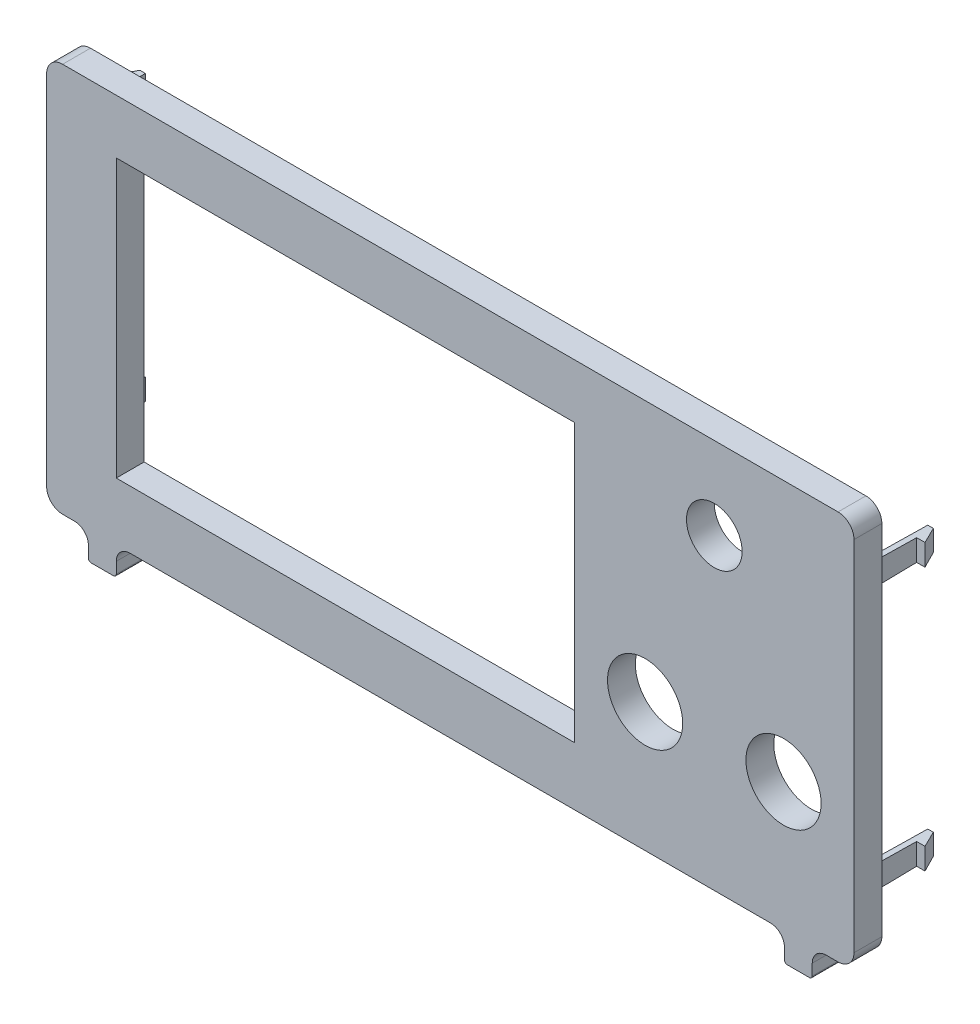
from build123d import *
from OCP.BRepFilletAPI import BRepFilletAPI_MakeFillet

# Parameters (mm, degrees)
SKETCH1_W            = 290
SKETCH1_H            = 140
MAIN_BODY_DEPTH      = 10
SKETCH2_W            = 164.64
SKETCH2_H            = 99.6
DISPLAY_DEPTH        = 10
SKETCH5_W            = 10
SKETCH5_H            = 10
FEET_DEPTH           = 10
FEET_FILLETS_R1      = 5
FEET_FILLETS_R2      = 1
SKETCH8_R            = 10
ROTARY_ENCODER_DEPTH = 10
SKETCH9_R            = 13.5
CONNECTORS_DEPTH     = 10
SNAP_START           = 285.5
SNAP_HOOK1_DEPTH     = 2
SNAP_START_2         = -26.59133039
SNAP_HOOK1_2_DEPTH   = 7.70946078
SNAP_START_3         = 287.5
SNAP_HOOK1_3_DEPTH   = 3.5
SNAP_HOOK2_DEPTH     = 2
SNAP_START_4         = -121.11813039
SNAP_HOOK2_2_DEPTH   = 7.70946078
SNAP_HOOK2_3_DEPTH   = 3.5
SNAP_START_5         = 2.5
SNAP_HOOK3_DEPTH     = 2
SNAP_HOOK3_2_DEPTH   = 7.70946078
SNAP_START_6         = -1
SNAP_HOOK3_3_DEPTH   = 3.5
SNAP_HOOK4_DEPTH     = 2
SNAP_HOOK4_2_DEPTH   = 7.70946078
SNAP_HOOK4_3_DEPTH   = 3.5
SIDE_FILLETS_R       = 5.7366
SKETCH11_R           = 1.5
DISPLAY_HOLES_DEPTH  = 7


with BuildPart() as part:
    # Sketch1 → Main Body (new body)
    with BuildSketch(Plane.XY):
        with Locations((145, -70)):
            Rectangle(SKETCH1_W, SKETCH1_H)
    extrude(amount=MAIN_BODY_DEPTH)

    # Sketch2 → Display (cut)
    with BuildSketch(Plane(origin=(0, 0, 0), x_dir=(-1, 0, 0), z_dir=(0, 0, -1))):
        with Locations((-107.32, -69.3)):
            Rectangle(SKETCH2_W, SKETCH2_H)
    extrude(amount=-DISPLAY_DEPTH, mode=Mode.SUBTRACT)

    # Sketch5 → Feet (add)
    with BuildSketch(Plane.XZ.offset(140)):
        with Locations((20, 5)):
            Rectangle(SKETCH5_W, SKETCH5_H)
        with Locations((270, 5)):
            Rectangle(SKETCH5_W, SKETCH5_H)
    extrude(amount=FEET_DEPTH)

    # Feet Fillets: one fillet with a radius per group of edges: ONE call of the kernel's fillet builder (fillet() takes one radius for all edges)
    feet_fillets_edges_1 = [part.edges().sort_by_distance(p)[0] for p in [
        (15, -140, 5),
        (25, -140, 5),
        (275, -140, 5),
        (265, -140, 5),
    ]]
    feet_fillets_edges_2 = [part.edges().sort_by_distance(p)[0] for p in [
        (265, -150, 5),
        (275, -150, 5),
        (25, -150, 5),
        (15, -150, 5),
    ]]
    feet_fillets = BRepFilletAPI_MakeFillet(part.part.solid().wrapped)
    for e in feet_fillets_edges_1:
        feet_fillets.Add(FEET_FILLETS_R1, e.wrapped)
    for e in feet_fillets_edges_2:
        feet_fillets.Add(FEET_FILLETS_R2, e.wrapped)
    add(Compound.cast(feet_fillets.Shape()), mode=Mode.REPLACE)

    # Sketch8 → Rotary Encoder (cut)
    with BuildSketch(Plane.XY.offset(10)):
        with Locations((239.82, -29.550599566)):
            Circle(SKETCH8_R)
    extrude(amount=-ROTARY_ENCODER_DEPTH, mode=Mode.SUBTRACT)

    # Sketch9 → Connectors (cut)
    with BuildSketch(Plane.XY.offset(10)):
        with Locations((214.961120299, -93.741529743)):
            Circle(SKETCH9_R)
        with Locations((264.678879701, -93.741529743)):
            Circle(SKETCH9_R)
    extrude(amount=-CONNECTORS_DEPTH, mode=Mode.SUBTRACT)

    # Snap Hook1: read off the stored shape, not the designer's step
    # Snap Hook1 outline → Snap Hook1 (add)
    with BuildSketch(Plane.YZ.offset(SNAP_START)):
        Polygon((-26.4866, -21), (-18.9866, -21), (-18.620043637, 0), (-26.853156363, 0), align=None)
    extrude(amount=SNAP_HOOK1_DEPTH)

    # Snap Hook1 2 outline → Snap Hook1 2 (add)
    with BuildSketch(Plane(origin=(0, 0, 0), x_dir=(1, 0, 0), z_dir=(0, 1, 0)).offset(SNAP_START_2)):
        Polygon((287.5, 15), (290.5, 15), (287.5, 21), align=None)
    extrude(amount=SNAP_HOOK1_2_DEPTH)

    # Snap Hook1 3 outline → Snap Hook1 3 (cut)
    with BuildSketch(Plane.YZ.offset(SNAP_START_3)):
        Polygon((-18.881869611, -15), (-18.9866, -21), (-19.004055065, -22), (-18.88186961, -22), align=None)
        Polygon((-26.59133039, -22), (-26.469144935, -22), (-26.4866, -21), (-26.591330389, -15), align=None)
    extrude(amount=SNAP_HOOK1_3_DEPTH, mode=Mode.SUBTRACT)

    # Snap Hook2: read off the stored shape, not the designer's step
    # Snap Hook2 outline → Snap Hook2 (add)
    with BuildSketch(Plane.YZ.offset(SNAP_START)):
        Polygon((-121.0134, -21), (-113.5134, -21), (-113.146843637, 0), (-121.379956363, 0), align=None)
    extrude(amount=SNAP_HOOK2_DEPTH)

    # Snap Hook2 2 outline → Snap Hook2 2 (add)
    with BuildSketch(Plane(origin=(0, 0, 0), x_dir=(1, 0, 0), z_dir=(0, 1, 0)).offset(SNAP_START_4)):
        Polygon((287.5, 15), (290.5, 15), (287.5, 21), align=None)
    extrude(amount=SNAP_HOOK2_2_DEPTH)

    # Snap Hook2 3 outline → Snap Hook2 3 (cut)
    with BuildSketch(Plane.YZ.offset(SNAP_START_3)):
        Polygon((-113.408669611, -15), (-113.5134, -21), (-113.530855065, -22), (-113.40866961, -22), align=None)
        Polygon((-121.11813039, -22), (-120.995944935, -22), (-121.0134, -21), (-121.118130389, -15), align=None)
    extrude(amount=SNAP_HOOK2_3_DEPTH, mode=Mode.SUBTRACT)

    # Snap Hook3: read off the stored shape, not the designer's step
    # Snap Hook3 outline → Snap Hook3 (add)
    with BuildSketch(Plane.YZ.offset(SNAP_START_5)):
        Polygon((-26.4866, -21), (-18.9866, -21), (-18.620043637, 0), (-26.853156363, 0), align=None)
    extrude(amount=SNAP_HOOK3_DEPTH)

    # Snap Hook3 2 outline → Snap Hook3 2 (add)
    with BuildSketch(Plane(origin=(0, 0, 0), x_dir=(1, 0, 0), z_dir=(0, 1, 0)).offset(SNAP_START_2)):
        Polygon((2.5, 21), (-0.5, 15), (2.5, 15), align=None)
    extrude(amount=SNAP_HOOK3_2_DEPTH)

    # Snap Hook3 3 outline → Snap Hook3 3 (cut)
    with BuildSketch(Plane.YZ.offset(SNAP_START_6)):
        Polygon((-18.881869611, -15), (-18.9866, -21), (-19.004055065, -22), (-18.88186961, -22), align=None)
        Polygon((-26.59133039, -22), (-26.469144935, -22), (-26.4866, -21), (-26.591330389, -15), align=None)
    extrude(amount=SNAP_HOOK3_3_DEPTH, mode=Mode.SUBTRACT)

    # Snap Hook4: read off the stored shape, not the designer's step
    # Snap Hook4 outline → Snap Hook4 (add)
    with BuildSketch(Plane.YZ.offset(SNAP_START_5)):
        Polygon((-121.0134, -21), (-113.5134, -21), (-113.146843637, 0), (-121.379956363, 0), align=None)
    extrude(amount=SNAP_HOOK4_DEPTH)

    # Snap Hook4 2 outline → Snap Hook4 2 (add)
    with BuildSketch(Plane(origin=(0, 0, 0), x_dir=(1, 0, 0), z_dir=(0, 1, 0)).offset(SNAP_START_4)):
        Polygon((2.5, 21), (-0.5, 15), (2.5, 15), align=None)
    extrude(amount=SNAP_HOOK4_2_DEPTH)

    # Snap Hook4 3 outline → Snap Hook4 3 (cut)
    with BuildSketch(Plane.YZ.offset(SNAP_START_6)):
        Polygon((-113.408669611, -15), (-113.5134, -21), (-113.530855065, -22), (-113.40866961, -22), align=None)
        Polygon((-121.11813039, -22), (-120.995944935, -22), (-121.0134, -21), (-121.118130389, -15), align=None)
    extrude(amount=SNAP_HOOK4_3_DEPTH, mode=Mode.SUBTRACT)

    # Side Fillets
    side_fillets_edges = [part.edges().sort_by_distance(p)[0] for p in [
        (0, 0, 5),
        (290, 0, 5),
        (290, -140, 5),
        (0, -140, 5),
    ]]
    fillet(side_fillets_edges, radius=SIDE_FILLETS_R)

    # Sketch11 → Display Holes (cut)
    with BuildSketch(Plane(origin=(0, 0, 0), x_dir=(-1, 0, 0), z_dir=(0, 0, -1))):
        with Locations((-185.77, -11.82)):
            Circle(SKETCH11_R)
        with Locations((-28.87, -11.82)):
            Circle(SKETCH11_R)
        with Locations((-185.77, -126.78)):
            Circle(SKETCH11_R)
        with Locations((-28.87, -126.78)):
            Circle(SKETCH11_R)
    extrude(amount=-DISPLAY_HOLES_DEPTH, mode=Mode.SUBTRACT)


solid = part.part
